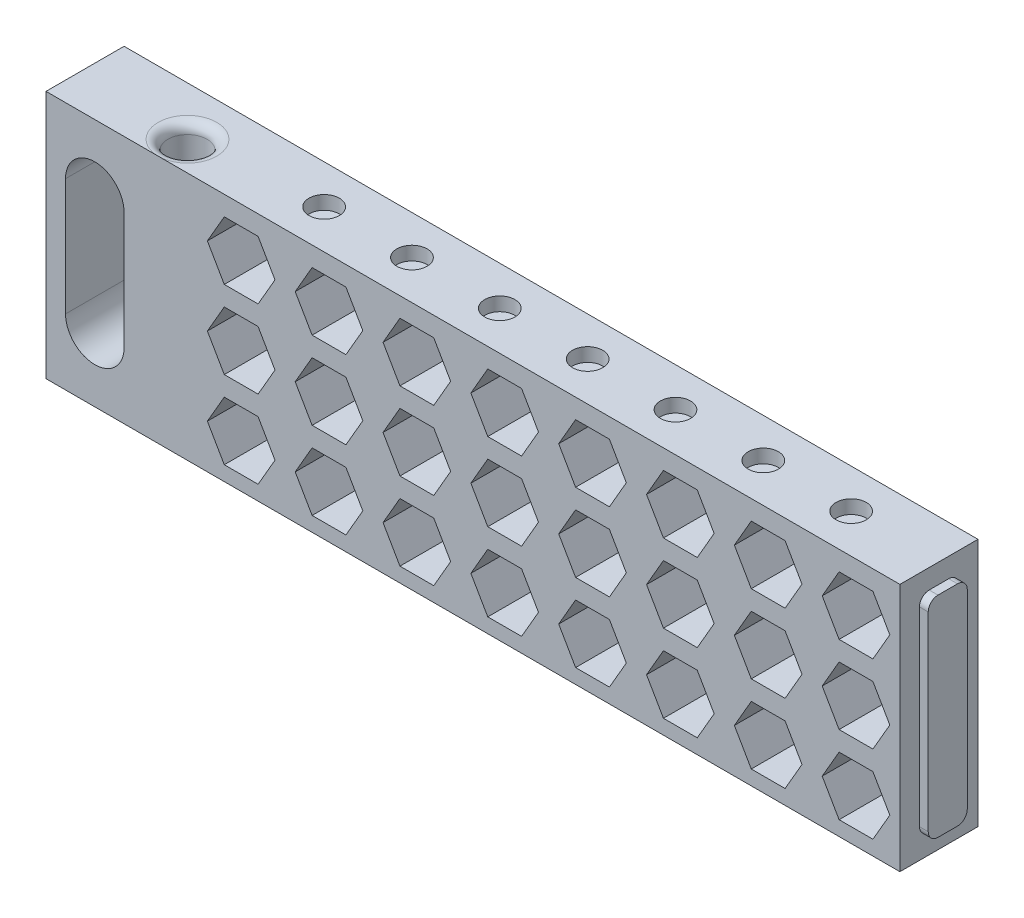
from build123d import *

# Parameters (mm, degrees)
SKETCH1_W           = 330
SKETCH1_H           = 16
BOSS_EXTRUDE1_DEPTH = 51
CUT_EXTRUDE1_REACH  = 336.301
SKETCH2_R           = 3.999999999999999
SKETCH2_R_2         = 3.9999999999999933
CUT_EXTRUDE2_DEPTH  = 16
CUT_EXTRUDE3_REACH  = 336.301
FILLET1_R           = 2
SKETCH5_R           = 3.100000000000002
SKETCH5_R_2         = 3.1000000000000023
SKETCH5_R_3         = 3.099999999999988
CUT_EXTRUDE4_DEPTH  = 2.8
CUT_EXTRUDE5_START  = -16
CUT_EXTRUDE5_DEPTH  = 16
COVER_DEPTH         = 2.8
BOSS_EXTRUDE3_DEPTH = 1.8
FILLET2_R           = 2
FILLET3_R           = 2
BOSS_EXTRUDE4_DEPTH = 2.8


# Read off the part's stored shape, not the designer's step: Cut-Extrude5
with BuildPart() as part:
    # Sketch1 → Boss-Extrude1 (new body)
    with BuildSketch(Plane(origin=(0, 0, 0), x_dir=(1, 0, 0), z_dir=(0, 1, 0))):
        with Locations((165, 8)):
            Rectangle(SKETCH1_W, SKETCH1_H)
    extrude(amount=BOSS_EXTRUDE1_DEPTH)

    # Sketch2 → Cut-Extrude1 (cut, up to next)
    with BuildSketch(Plane(origin=(0, 51, 0), x_dir=(1, 0, 0), z_dir=(0, 1, 0)), mode=Mode.PRIVATE) as cut_extrude1_sk1:
        with Locations(Location((23, 6, 0), (0, 0, 270))):
            Circle(SKETCH2_R)
    cut_extrude1_tool1 = extrude(cut_extrude1_sk1.sketch, amount=-CUT_EXTRUDE1_REACH, mode=Mode.PRIVATE) & part.part
    # Sketch2 → Cut-Extrude1 (cut, up to next)
    with BuildSketch(Plane(origin=(0, 51, 0), x_dir=(1, 0, 0), z_dir=(0, 1, 0)), mode=Mode.PRIVATE) as cut_extrude1_sk2:
        with Locations(Location((305.575, 6, 0), (0, 0, 270))):
            Circle(SKETCH2_R_2)
    cut_extrude1_tool2 = extrude(cut_extrude1_sk2.sketch, amount=-CUT_EXTRUDE1_REACH, mode=Mode.PRIVATE) & part.part
    add(cut_extrude1_tool1.solids().sort_by_distance((23, 51, -6))[0], mode=Mode.SUBTRACT)
    add(cut_extrude1_tool2.solids().sort_by_distance((305.575, 51, -6))[0], mode=Mode.SUBTRACT)

    # Sketch3 → Cut-Extrude2 (cut)
    with BuildSketch(Plane.XY):
        Polygon((43.46410161513775, 34.99999999999999), (46.92820323027551, 40.99999999999999), (43.46410161513776, 46.999999999999986), (36.53589838486224, 46.999999999999986), (33.07179676972449, 40.999999999999986), (36.53589838486225, 34.99999999999999), align=None)
        Polygon((61.46410161513775, 34.99999999999999), (64.92820323027551, 40.99999999999999), (61.46410161513775, 46.999999999999986), (54.535898384862236, 46.999999999999986), (51.07179676972449, 40.999999999999986), (54.53589838486225, 34.99999999999999), align=None)
        Polygon((79.46410161513775, 34.99999999999999), (82.9282032302755, 40.99999999999999), (79.46410161513775, 46.999999999999986), (72.53589838486224, 46.999999999999986), (69.0717967697245, 40.999999999999986), (72.53589838486224, 34.99999999999999), align=None)
        Polygon((97.46410161513775, 34.99999999999999), (100.9282032302755, 40.99999999999999), (97.46410161513775, 46.999999999999986), (90.53589838486224, 46.999999999999986), (87.07179676972449, 40.999999999999986), (90.53589838486224, 34.99999999999999), align=None)
        Polygon((115.46410161513775, 34.99999999999999), (118.9282032302755, 40.99999999999999), (115.46410161513776, 46.999999999999986), (108.53589838486225, 46.999999999999986), (105.07179676972449, 40.999999999999986), (108.53589838486225, 34.99999999999999), align=None)
        Polygon((133.46410161513774, 34.99999999999999), (136.9282032302755, 40.99999999999999), (133.46410161513774, 46.999999999999986), (126.53589838486224, 46.999999999999986), (123.07179676972449, 40.999999999999986), (126.53589838486224, 34.99999999999999), align=None)
        Polygon((151.46410161513774, 34.99999999999999), (154.9282032302755, 40.99999999999999), (151.46410161513774, 46.999999999999986), (144.5358983848622, 46.999999999999986), (141.07179676972447, 40.999999999999986), (144.53589838486224, 34.99999999999999), align=None)
        Polygon((169.46410161513776, 34.99999999999999), (172.92820323027553, 40.99999999999999), (169.46410161513776, 46.999999999999986), (162.53589838486224, 46.999999999999986), (159.0717967697245, 40.999999999999986), (162.53589838486226, 34.99999999999999), align=None)
        Polygon((187.46410161513774, 34.99999999999999), (190.92820323027547, 40.99999999999999), (187.46410161513774, 46.999999999999986), (180.53589838486224, 46.999999999999986), (177.07179676972447, 40.999999999999986), (180.53589838486224, 34.99999999999999), align=None)
        Polygon((205.46410161513774, 34.99999999999999), (208.9282032302755, 40.99999999999999), (205.46410161513774, 46.999999999999986), (198.5358983848622, 46.999999999999986), (195.07179676972447, 40.999999999999986), (198.53589838486224, 34.99999999999999), align=None)
        Polygon((223.46410161513774, 34.99999999999999), (226.92820323027553, 40.99999999999999), (223.46410161513774, 46.999999999999986), (216.53589838486224, 46.999999999999986), (213.0717967697245, 40.999999999999986), (216.53589838486226, 34.99999999999999), align=None)
        Polygon((241.46410161513774, 34.99999999999999), (244.92820323027547, 40.99999999999999), (241.46410161513774, 46.999999999999986), (234.5358983848622, 46.999999999999986), (231.07179676972447, 40.999999999999986), (234.5358983848622, 34.99999999999999), align=None)
        Polygon((259.46410161513774, 34.99999999999999), (262.92820323027547, 40.99999999999999), (259.46410161513774, 46.999999999999986), (252.53589838486224, 46.999999999999986), (249.07179676972447, 40.999999999999986), (252.53589838486224, 34.99999999999999), align=None)
        Polygon((277.46410161513774, 34.99999999999999), (280.9282032302755, 40.99999999999999), (277.46410161513774, 46.999999999999986), (270.53589838486226, 46.999999999999986), (267.0717967697245, 40.999999999999986), (270.53589838486226, 34.99999999999999), align=None)
        Polygon((295.46410161513774, 34.99999999999999), (298.9282032302755, 40.99999999999999), (295.46410161513774, 46.999999999999986), (288.53589838486226, 46.999999999999986), (285.0717967697245, 40.999999999999986), (288.53589838486226, 34.99999999999999), align=None)
        Polygon((61.46410161513792, 18.99999999999999), (64.92820323027567, 24.999999999999993), (61.46410161513792, 30.999999999999986), (54.535898384862406, 30.999999999999986), (51.07179676972466, 24.999999999999986), (54.53589838486242, 18.99999999999999), align=None)
        Polygon((79.46410161513792, 18.99999999999999), (82.92820323027567, 24.999999999999993), (79.46410161513792, 30.999999999999986), (72.5358983848624, 30.999999999999986), (69.07179676972467, 24.999999999999986), (72.5358983848624, 18.99999999999999), align=None)
        Polygon((97.4641016151379, 18.99999999999999), (100.92820323027567, 24.999999999999993), (97.4641016151379, 30.999999999999986), (90.53589838486239, 30.999999999999986), (87.07179676972466, 24.999999999999986), (90.5358983848624, 18.99999999999999), align=None)
        Polygon((115.4641016151379, 18.99999999999999), (118.92820323027567, 24.999999999999993), (115.46410161513792, 30.999999999999986), (108.5358983848624, 30.999999999999986), (105.07179676972466, 24.999999999999986), (108.5358983848624, 18.99999999999999), align=None)
        Polygon((133.4641016151379, 18.99999999999999), (136.92820323027567, 24.999999999999993), (133.4641016151379, 30.999999999999986), (126.5358983848624, 30.999999999999986), (123.07179676972466, 24.999999999999986), (126.5358983848624, 18.99999999999999), align=None)
        Polygon((151.4641016151379, 18.99999999999999), (154.92820323027567, 24.999999999999993), (151.4641016151379, 30.999999999999986), (144.53589838486238, 30.999999999999986), (141.07179676972464, 24.999999999999986), (144.5358983848624, 18.99999999999999), align=None)
        Polygon((169.4641016151379, 18.99999999999999), (172.9282032302757, 24.999999999999993), (169.4641016151379, 30.999999999999986), (162.5358983848624, 30.999999999999986), (159.07179676972467, 24.999999999999986), (162.53589838486243, 18.99999999999999), align=None)
        Polygon((187.4641016151379, 18.99999999999999), (190.92820323027564, 24.999999999999993), (187.4641016151379, 30.999999999999986), (180.53589838486238, 30.999999999999986), (177.07179676972464, 24.999999999999986), (180.53589838486238, 18.99999999999999), align=None)
        Polygon((205.4641016151379, 18.99999999999999), (208.92820323027567, 24.999999999999993), (205.4641016151379, 30.999999999999986), (198.53589838486238, 30.999999999999986), (195.07179676972464, 24.999999999999986), (198.5358983848624, 18.99999999999999), align=None)
        Polygon((223.4641016151379, 18.99999999999999), (226.92820323027567, 24.999999999999993), (223.4641016151379, 30.999999999999986), (216.5358983848624, 30.999999999999986), (213.07179676972464, 24.999999999999986), (216.53589838486243, 18.99999999999999), align=None)
        Polygon((241.4641016151379, 18.99999999999999), (244.92820323027564, 24.999999999999993), (241.4641016151379, 30.999999999999986), (234.53589838486238, 30.999999999999986), (231.07179676972464, 24.999999999999986), (234.53589838486238, 18.99999999999999), align=None)
        Polygon((259.4641016151379, 18.99999999999999), (262.92820323027564, 24.999999999999993), (259.4641016151379, 30.999999999999986), (252.5358983848624, 30.999999999999986), (249.07179676972464, 24.999999999999986), (252.5358983848624, 18.99999999999999), align=None)
        Polygon((277.4641016151379, 18.99999999999999), (280.9282032302757, 24.999999999999993), (277.4641016151379, 30.999999999999986), (270.53589838486243, 30.999999999999986), (267.07179676972464, 24.999999999999986), (270.53589838486243, 18.99999999999999), align=None)
        Polygon((295.4641016151379, 18.99999999999999), (298.9282032302757, 24.999999999999993), (295.4641016151379, 30.999999999999986), (288.53589838486243, 30.999999999999986), (285.07179676972464, 24.999999999999986), (288.53589838486243, 18.99999999999999), align=None)
        Polygon((61.464101615138084, 2.999999999999989), (64.92820323027584, 8.999999999999995), (61.464101615138084, 14.999999999999986), (54.53589838486257, 14.999999999999986), (51.07179676972483, 8.999999999999988), (54.535898384862584, 2.999999999999989), align=None)
        Polygon((79.46410161513809, 2.999999999999989), (82.92820323027583, 8.999999999999995), (79.46410161513809, 14.999999999999986), (72.53589838486258, 14.999999999999986), (69.07179676972483, 8.999999999999988), (72.53589838486258, 2.999999999999989), align=None)
        Polygon((97.46410161513808, 2.999999999999989), (100.92820323027584, 8.999999999999995), (97.46410161513808, 14.999999999999986), (90.53589838486256, 14.999999999999986), (87.07179676972481, 8.999999999999988), (90.53589838486258, 2.999999999999989), align=None)
        Polygon((115.46410161513808, 2.999999999999989), (118.92820323027584, 8.999999999999995), (115.46410161513809, 14.999999999999986), (108.53589838486258, 14.999999999999986), (105.07179676972483, 8.999999999999988), (108.53589838486258, 2.999999999999989), align=None)
        Polygon((133.46410161513808, 2.999999999999989), (136.9282032302758, 8.999999999999995), (133.46410161513808, 14.999999999999986), (126.53589838486256, 14.999999999999986), (123.07179676972483, 8.999999999999988), (126.53589838486256, 2.999999999999989), align=None)
        Polygon((151.46410161513808, 2.999999999999989), (154.92820323027584, 8.999999999999995), (151.46410161513808, 14.999999999999986), (144.53589838486255, 14.999999999999986), (141.0717967697248, 8.999999999999988), (144.53589838486258, 2.999999999999989), align=None)
        Polygon((169.46410161513808, 2.999999999999989), (172.92820323027587, 8.999999999999995), (169.46410161513808, 14.999999999999986), (162.53589838486258, 14.999999999999986), (159.0717967697248, 8.999999999999988), (162.5358983848626, 2.999999999999989), align=None)
        Polygon((187.46410161513808, 2.999999999999989), (190.9282032302758, 8.999999999999995), (187.46410161513808, 14.999999999999986), (180.53589838486255, 14.999999999999986), (177.0717967697248, 8.999999999999988), (180.53589838486255, 2.999999999999989), align=None)
        Polygon((205.46410161513805, 2.999999999999989), (208.92820323027584, 8.999999999999995), (205.46410161513805, 14.999999999999986), (198.53589838486255, 14.999999999999986), (195.0717967697248, 8.999999999999988), (198.53589838486258, 2.999999999999989), align=None)
        Polygon((223.46410161513808, 2.999999999999989), (226.92820323027584, 8.999999999999995), (223.46410161513808, 14.999999999999986), (216.53589838486258, 14.999999999999986), (213.0717967697248, 8.999999999999988), (216.53589838486258, 2.999999999999989), align=None)
        Polygon((241.46410161513808, 2.999999999999989), (244.9282032302758, 8.999999999999995), (241.46410161513808, 14.999999999999986), (234.53589838486255, 14.999999999999986), (231.0717967697248, 8.999999999999988), (234.53589838486255, 2.999999999999989), align=None)
        Polygon((259.4641016151381, 2.999999999999989), (262.9282032302758, 8.999999999999995), (259.4641016151381, 14.999999999999986), (252.53589838486258, 14.999999999999986), (249.07179676972478, 8.999999999999988), (252.53589838486258, 2.999999999999989), align=None)
        Polygon((277.4641016151381, 2.999999999999989), (280.92820323027587, 8.999999999999995), (277.4641016151381, 14.999999999999986), (270.5358983848626, 14.999999999999986), (267.0717967697248, 8.999999999999988), (270.5358983848626, 2.999999999999989), align=None)
        Polygon((295.4641016151381, 2.999999999999989), (298.92820323027587, 8.999999999999995), (295.4641016151381, 14.999999999999986), (288.5358983848626, 14.999999999999986), (285.0717967697248, 8.999999999999988), (288.5358983848626, 2.999999999999989), align=None)
        Polygon((43.46410161513792, 18.99999999999999), (46.92820323027568, 24.999999999999993), (43.46410161513793, 30.999999999999986), (36.53589838486241, 30.999999999999986), (33.071796769724656, 24.999999999999986), (36.53589838486241, 18.99999999999999), align=None)
        Polygon((43.464101615138084, 2.999999999999989), (46.92820323027584, 8.999999999999995), (43.46410161513809, 14.999999999999986), (36.53589838486258, 14.999999999999986), (33.07179676972483, 8.999999999999988), (36.535898384862584, 2.999999999999989), align=None)
    extrude(amount=-CUT_EXTRUDE2_DEPTH, mode=Mode.SUBTRACT)

    # Sketch4 → Cut-Extrude3 (cut, up to next)
    with BuildSketch(Plane.XY, mode=Mode.PRIVATE) as cut_extrude3_sk1:
        with BuildLine():
            Line((4.000000000000005, 13.499999999999998), (4.000000000000005, 37.5))
            ThreePointArc((4.000000000000005, 37.5), (10.000000000000005, 43.5), (16.000000000000007, 37.5))
            Line((16.000000000000007, 37.5), (16.000000000000007, 13.499999999999998))
            ThreePointArc((16.000000000000007, 13.499999999999998), (10.000000000000004, 7.499999999999998), (4.000000000000005, 13.499999999999998))
        make_face()
    cut_extrude3_tool1 = extrude(cut_extrude3_sk1.sketch, amount=-CUT_EXTRUDE3_REACH, mode=Mode.PRIVATE) & part.part
    # Sketch4 → Cut-Extrude3 (cut, up to next)
    with BuildSketch(Plane.XY, mode=Mode.PRIVATE) as cut_extrude3_sk2:
        with BuildLine():
            Line((326, 13.499999999999998), (326, 37.5))
            ThreePointArc((326, 37.5), (320, 43.5), (314, 37.5))
            Line((314, 37.5), (314, 13.499999999999998))
            ThreePointArc((314, 13.499999999999998), (320, 7.499999999999998), (326, 13.499999999999998))
        make_face()
    cut_extrude3_tool2 = extrude(cut_extrude3_sk2.sketch, amount=-CUT_EXTRUDE3_REACH, mode=Mode.PRIVATE) & part.part
    add(cut_extrude3_tool1.solids().sort_by_distance((10, 25.5, 0))[0], mode=Mode.SUBTRACT)
    add(cut_extrude3_tool2.solids().sort_by_distance((320, 25.5, 0))[0], mode=Mode.SUBTRACT)

    # Fillet1
    fillet1_edges = [part.edges().sort_by_distance(p)[0] for p in [
        (23, 0, -10),
        (305.575, 0, -9.999999999999993),
    ]]
    fillet(fillet1_edges, radius=FILLET1_R)

    # Sketch5 → Cut-Extrude4 (cut)
    with BuildSketch(Plane(origin=(0, 51, 0), x_dir=(1, 0, 0), z_dir=(0, 1, 0))):
        with Locations(Location((49, 8, 0), (0, 0, 270))):
            Circle(SKETCH5_R)
        with Locations(Location((67, 8, 0), (0, 0, 270))):
            Circle(SKETCH5_R_2)
        with Locations(Location((84.99999999999999, 8, 0), (0, 0, 270))):
            Circle(SKETCH5_R_2)
        with Locations(Location((103, 8, 0), (0, 0, 270))):
            Circle(SKETCH5_R_2)
        with Locations(Location((121, 8, 0), (0, 0, 270))):
            Circle(SKETCH5_R_2)
        with Locations(Location((139, 8, 0), (0, 0, 270))):
            Circle(SKETCH5_R_3)
        with Locations(Location((156.99999999999997, 8, 0), (0, 0, 270))):
            Circle(SKETCH5_R_3)
        with Locations(Location((175, 8, 0), (0, 0, 270))):
            Circle(SKETCH5_R_3)
        with Locations(Location((193, 8, 0), (0, 0, 270))):
            Circle(SKETCH5_R_3)
        with Locations(Location((210.99999999999997, 8, 0), (0, 0, 270))):
            Circle(SKETCH5_R_3)
        with Locations(Location((228.99999999999997, 8, 0), (0, 0, 270))):
            Circle(SKETCH5_R_3)
        with Locations(Location((247, 8, 0), (0, 0, 270))):
            Circle(SKETCH5_R_3)
        with Locations(Location((264.99999999999994, 8, 0), (0, 0, 270))):
            Circle(SKETCH5_R_3)
        with Locations(Location((283, 8, 0), (0, 0, 270))):
            Circle(SKETCH5_R_3)
    cut_extrude4 = extrude(amount=-CUT_EXTRUDE4_DEPTH, mode=Mode.SUBTRACT)

    # Cut-Extrude5 outline → Cut-Extrude5 (cut)
    with BuildSketch(Plane.XY.offset(CUT_EXTRUDE5_START)):
        Polygon((330, 51), (175, 51), (175, 48.2), (175, 0), (330, 0), align=None)
        Polygon((187.464101615, 3), (180.535898385, 3), (177.07179677, 9), (180.535898385, 15), (187.464101615, 15), (190.92820323, 9), align=None, mode=Mode.SUBTRACT)
        Polygon((205.464101615, 3), (198.535898385, 3), (195.07179677, 9), (198.535898385, 15), (205.464101615, 15), (208.92820323, 9), align=None, mode=Mode.SUBTRACT)
        Polygon((223.464101615, 3), (216.535898385, 3), (213.07179677, 9), (216.535898385, 15), (223.464101615, 15), (226.92820323, 9), align=None, mode=Mode.SUBTRACT)
        Polygon((241.464101615, 3), (234.535898385, 3), (231.07179677, 9), (234.535898385, 15), (241.464101615, 15), (244.92820323, 9), align=None, mode=Mode.SUBTRACT)
        Polygon((187.464101615, 19), (180.535898385, 19), (177.07179677, 25), (180.535898385, 31), (187.464101615, 31), (190.92820323, 25), align=None, mode=Mode.SUBTRACT)
        Polygon((205.464101615, 19), (198.535898385, 19), (195.07179677, 25), (198.535898385, 31), (205.464101615, 31), (208.92820323, 25), align=None, mode=Mode.SUBTRACT)
        Polygon((223.464101615, 19), (216.535898385, 19), (213.07179677, 25), (216.535898385, 31), (223.464101615, 31), (226.92820323, 25), align=None, mode=Mode.SUBTRACT)
        Polygon((241.464101615, 19), (234.535898385, 19), (231.07179677, 25), (234.535898385, 31), (241.464101615, 31), (244.92820323, 25), align=None, mode=Mode.SUBTRACT)
        Polygon((259.464101615, 3), (252.535898385, 3), (249.07179677, 9), (252.535898385, 15), (259.464101615, 15), (262.92820323, 9), align=None, mode=Mode.SUBTRACT)
        Polygon((277.464101615, 3), (270.535898385, 3), (267.07179677, 9), (270.535898385, 15), (277.464101615, 15), (280.92820323, 9), align=None, mode=Mode.SUBTRACT)
        Polygon((295.464101615, 3), (288.535898385, 3), (285.07179677, 9), (288.535898385, 15), (295.464101615, 15), (298.92820323, 9), align=None, mode=Mode.SUBTRACT)
        Polygon((259.464101615, 19), (252.535898385, 19), (249.07179677, 25), (252.535898385, 31), (259.464101615, 31), (262.92820323, 25), align=None, mode=Mode.SUBTRACT)
        Polygon((277.464101615, 19), (270.535898385, 19), (267.07179677, 25), (270.535898385, 31), (277.464101615, 31), (280.92820323, 25), align=None, mode=Mode.SUBTRACT)
        Polygon((295.464101615, 19), (288.535898385, 19), (285.07179677, 25), (288.535898385, 31), (295.464101615, 31), (298.92820323, 25), align=None, mode=Mode.SUBTRACT)
        Polygon((187.464101615, 35), (180.535898385, 35), (177.07179677, 41), (180.535898385, 47), (187.464101615, 47), (190.92820323, 41), align=None, mode=Mode.SUBTRACT)
        Polygon((205.464101615, 35), (198.535898385, 35), (195.07179677, 41), (198.535898385, 47), (205.464101615, 47), (208.92820323, 41), align=None, mode=Mode.SUBTRACT)
        Polygon((223.464101615, 35), (216.535898385, 35), (213.07179677, 41), (216.535898385, 47), (223.464101615, 47), (226.92820323, 41), align=None, mode=Mode.SUBTRACT)
        Polygon((241.464101615, 35), (234.535898385, 35), (231.07179677, 41), (234.535898385, 47), (241.464101615, 47), (244.92820323, 41), align=None, mode=Mode.SUBTRACT)
        with BuildLine():
            ThreePointArc((326, 13.5), (320, 7.5), (314, 13.5))
            Line((314, 13.5), (314, 37.5))
            ThreePointArc((314, 37.5), (320, 43.5), (326, 37.5))
            Line((326, 37.5), (326, 13.5))
        make_face(mode=Mode.SUBTRACT)
        Polygon((259.464101615, 35), (252.535898385, 35), (249.07179677, 41), (252.535898385, 47), (259.464101615, 47), (262.92820323, 41), align=None, mode=Mode.SUBTRACT)
        Polygon((277.464101615, 35), (270.535898385, 35), (267.07179677, 41), (270.535898385, 47), (277.464101615, 47), (280.92820323, 41), align=None, mode=Mode.SUBTRACT)
        Polygon((295.464101615, 35), (288.535898385, 35), (285.07179677, 41), (288.535898385, 47), (295.464101615, 47), (298.92820323, 41), align=None, mode=Mode.SUBTRACT)
    extrude(amount=CUT_EXTRUDE5_DEPTH, mode=Mode.SUBTRACT)

    # Sketch8 → Cover (add)
    with BuildSketch(Plane(origin=(0, 51, 0), x_dir=(1, 0, 0), z_dir=(0, 1, 0))):
        with BuildLine():
            Line((175, 11.099999999999989), (175, 4.900000000000012))
            ThreePointArc((175, 4.900000000000012), (171.9, 8), (175, 11.099999999999989))
        make_face()
    extrude(amount=-COVER_DEPTH)

    # Sketch9 → Boss-Extrude3 (add)
    with BuildSketch(Plane(origin=(175, 0, 0), x_dir=(0, 0, -1), z_dir=(1, 0, 0))):
        Polygon((3.9999999999999947, 47), (11.99999999999999, 47), (12, 3.9999999999999827), (4, 3.999999999999981), align=None)
    extrude(amount=BOSS_EXTRUDE3_DEPTH)

    # Fillet2
    fillet2_edges = [part.edges().sort_by_distance(p)[0] for p in [
        (175.9, 47, -3.9999999999999947),
        (175.9, 3.999999999999981, -4),
        (175.9, 3.9999999999999827, -12),
        (175.9, 47, -11.99999999999999),
    ]]
    fillet(fillet2_edges, radius=FILLET2_R)

    # Mirror1: Cut-Extrude4 across plane
    add(cut_extrude4.mirror(Plane(origin=(0, 25.5, 0), x_dir=(0, 0, 1), z_dir=(0, -1, 0))), mode=Mode.SUBTRACT)

    # Fillet3
    fillet3_edges = [part.edges().sort_by_distance(p)[0] for p in [
        (23, 51, -10),
    ]]
    fillet(fillet3_edges, radius=FILLET3_R)

    # Sketch11 → Boss-Extrude4 (add)
    with BuildSketch(Plane.XZ):
        with BuildLine():
            Line((175, -11.099999999999989), (175, -4.900000000000012))
            ThreePointArc((175, -4.900000000000012), (171.9, -8), (175, -11.099999999999989))
        make_face()
    extrude(amount=-BOSS_EXTRUDE4_DEPTH)


solid = part.part
